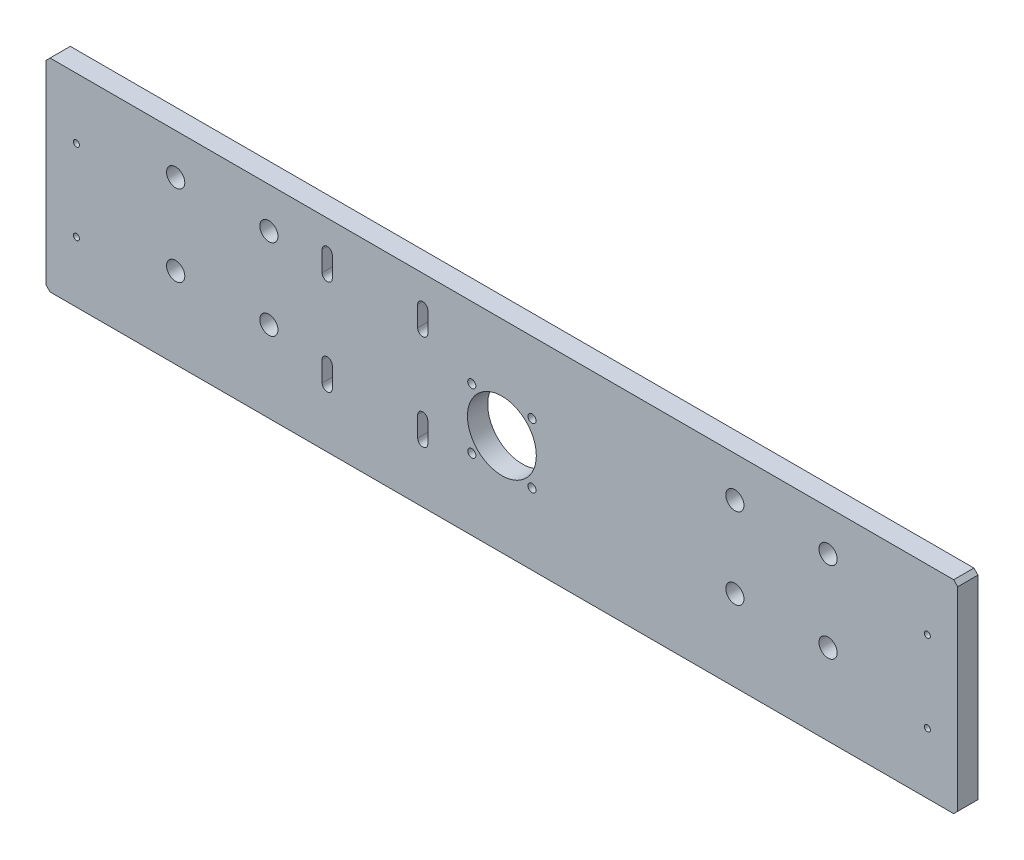
from build123d import *

# Parameters (mm, degrees)
SCHIZZO1_R          = 17
SCHIZZO1_R_2        = 2
SCHIZZO1_R_3        = 4.5
SCHIZZO1_R_4        = 1.5
BOSS_EXTRUDE1_DEPTH = 10
CUT_EXTRUDE1_DEPTH  = 462.085675336


with BuildPart() as part:
    # Schizzo1 → Boss-Extrude1 (new body)
    with BuildSketch(Plane.XY):
        Polygon((2, 0), (448, 0), (450, 2), (450, 98), (448, 100), (2, 100), (0, 98), (0, 2), align=None)
        with Locations((225, 50)):
            Circle(SCHIZZO1_R, mode=Mode.SUBTRACT)
        with Locations((239.849242405, 64.849242405)):
            Circle(SCHIZZO1_R_2, mode=Mode.SUBTRACT)
        with Locations((239.849242405, 35.150757595)):
            Circle(SCHIZZO1_R_2, mode=Mode.SUBTRACT)
        with Locations((210.150757595, 35.150757595)):
            Circle(SCHIZZO1_R_2, mode=Mode.SUBTRACT)
        with Locations((386, 40)):
            Circle(SCHIZZO1_R_3, mode=Mode.SUBTRACT)
        with Locations((386, 80)):
            Circle(SCHIZZO1_R_3, mode=Mode.SUBTRACT)
        with Locations((340, 40)):
            Circle(SCHIZZO1_R_3, mode=Mode.SUBTRACT)
        with Locations((340, 80)):
            Circle(SCHIZZO1_R_3, mode=Mode.SUBTRACT)
        with Locations((435, 70)):
            Circle(SCHIZZO1_R_4, mode=Mode.SUBTRACT)
        with Locations((435, 30)):
            Circle(SCHIZZO1_R_4, mode=Mode.SUBTRACT)
        with Locations((15, 30)):
            Circle(SCHIZZO1_R_4, mode=Mode.SUBTRACT)
        with Locations((210.150757595, 64.849242405)):
            Circle(SCHIZZO1_R_2, mode=Mode.SUBTRACT)
        with Locations((15, 70)):
            Circle(SCHIZZO1_R_4, mode=Mode.SUBTRACT)
        with Locations((110, 80)):
            Circle(SCHIZZO1_R_3, mode=Mode.SUBTRACT)
        with Locations((110, 40)):
            Circle(SCHIZZO1_R_3, mode=Mode.SUBTRACT)
        with Locations((64, 80)):
            Circle(SCHIZZO1_R_3, mode=Mode.SUBTRACT)
        with Locations((64, 40)):
            Circle(SCHIZZO1_R_3, mode=Mode.SUBTRACT)
    extrude(amount=-BOSS_EXTRUDE1_DEPTH)

    # Sketch1 → Cut-Extrude1 (cut, through all)
    with BuildSketch(Plane(origin=(0, 0, -10), x_dir=(-1, 0, 0), z_dir=(0, 0, -1))):
        with BuildLine():
            Line((-188.438059267, 75.37), (-188.438059267, 85.37))
            ThreePointArc((-188.438059267, 85.37), (-185.938059267, 87.87), (-183.438059267, 85.37))
            Line((-183.438059267, 85.37), (-183.438059267, 75.37))
            ThreePointArc((-183.438059267, 75.37), (-185.938059267, 72.87), (-188.438059267, 75.37))
        make_face()
        with BuildLine():
            Line((-141.298059267, 75.37), (-141.298059267, 85.37))
            ThreePointArc((-141.298059267, 85.37), (-138.798059267, 87.87), (-136.298059267, 85.37))
            Line((-136.298059267, 85.37), (-136.298059267, 75.37))
            ThreePointArc((-136.298059267, 75.37), (-138.798059267, 72.87), (-141.298059267, 75.37))
        make_face()
        with BuildLine():
            Line((-188.438059267, 28.23), (-188.438059267, 38.23))
            ThreePointArc((-188.438059267, 38.23), (-185.938059267, 40.73), (-183.438059267, 38.23))
            Line((-183.438059267, 38.23), (-183.438059267, 28.23))
            ThreePointArc((-183.438059267, 28.23), (-185.938059267, 25.73), (-188.438059267, 28.23))
        make_face()
        with BuildLine():
            Line((-141.298059267, 28.23), (-141.298059267, 38.23))
            ThreePointArc((-141.298059267, 38.23), (-138.798059267, 40.73), (-136.298059267, 38.23))
            Line((-136.298059267, 38.23), (-136.298059267, 28.23))
            ThreePointArc((-136.298059267, 28.23), (-138.798059267, 25.73), (-141.298059267, 28.23))
        make_face()
    extrude(amount=-CUT_EXTRUDE1_DEPTH, mode=Mode.SUBTRACT)


solid = part.part
